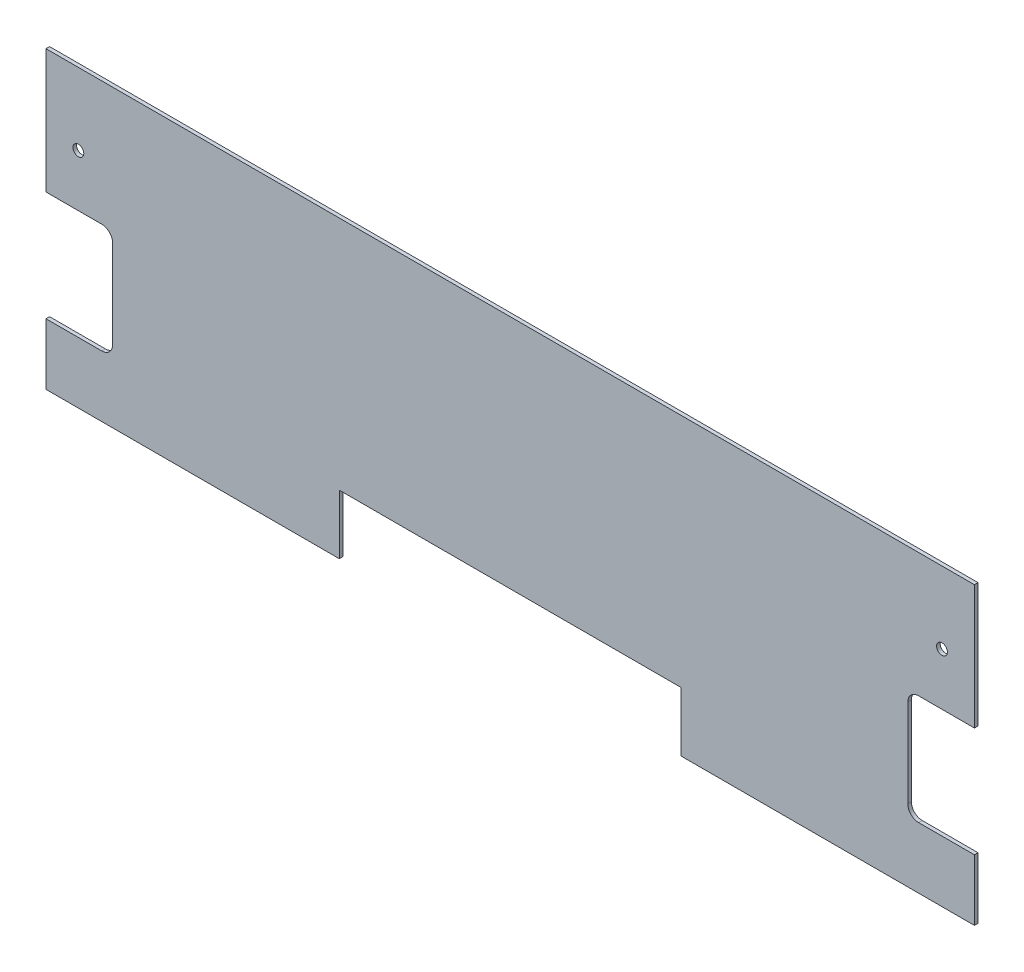
from build123d import *

# Parameters (mm, degrees)
T_LE_DE_BASE_PLI_E1_DEPTH = 1
ESQUISSE6_R               = 1.5
ESQUISSE6_W               = 18.5
ESQUISSE6_H               = 30.5
ENL_V_MAT_EXTRU_1_DEPTH   = 1
CONG_1_R                  = 3


# Sheet-metal steps are written as plain solids
with BuildPart() as part:
    # Esquisse1 → Tôle de base pliée1 (new body)
    with BuildSketch(Plane.XY):
        Polygon((47.5, -82), (129, -82), (129, 0), (-129, 0), (-129, -82), (-47.5, -82), (-47.5, -65.5), (47.5, -65.5), align=None)
    extrude(amount=-T_LE_DE_BASE_PLI_E1_DEPTH)

    # Esquisse6 → Enlèv. mat.-Extru.1 (cut)
    with BuildSketch(Plane.XY):
        with Locations((-120, -20)):
            Circle(ESQUISSE6_R)
        with Locations(Location((120, -20, 0), (0, 0, 180))):
            Circle(ESQUISSE6_R)
        with Locations((-119.75, -49.75)):
            Rectangle(ESQUISSE6_W, ESQUISSE6_H)
        with Locations((119.75, -49.75)):
            Rectangle(ESQUISSE6_W, ESQUISSE6_H)
    extrude(amount=-ENL_V_MAT_EXTRU_1_DEPTH, mode=Mode.SUBTRACT)

    # Congé1
    cong_1_edges = [part.edges().sort_by_distance(p)[0] for p in [
        (110.5, -65, -0.5),
        (110.5, -34.5, -0.5),
        (-110.5, -34.5, -0.5),
        (-110.5, -65, -0.5),
    ]]
    fillet(cong_1_edges, radius=CONG_1_R)


solid = part.part
